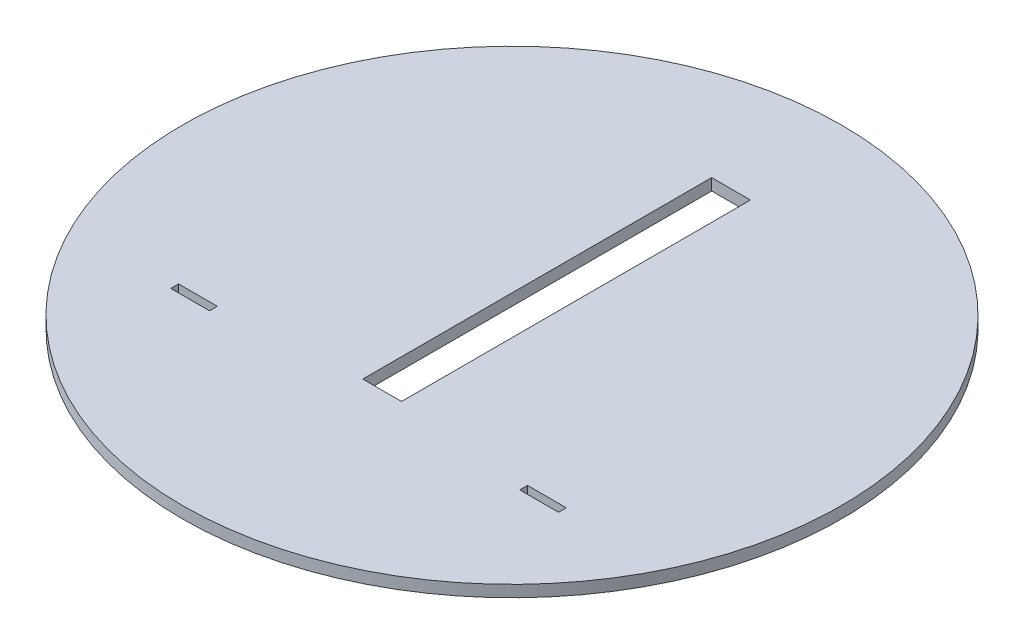
from build123d import *

# Parameters (mm, degrees)
SKETCH1_R           = 8.5
BOSS_EXTRUDE1_DEPTH = 0.15
CUT_EXTRUDE1_REACH  = 14.025
SKETCH2_W           = 1
SKETCH2_H           = 9
SKETCH2_H_2         = 0.2


with BuildPart() as part:
    # Sketch1 → Boss-Extrude1 (new, symmetric)
    with BuildSketch(Plane(origin=(0, 0, 0), x_dir=(1, 0, 0), z_dir=(0, 1, 0))):
        Circle(SKETCH1_R)
    extrude(amount=BOSS_EXTRUDE1_DEPTH, both=True)

    # Sketch2 → Cut-Extrude1 (cut, up to next)
    with BuildSketch(Plane(origin=(0, 0.15, 0), x_dir=(1, 0, 0), z_dir=(0, 1, 0)), mode=Mode.PRIVATE) as cut_extrude1_sk1:
        with Locations((0, 1.15)):
            Rectangle(SKETCH2_W, SKETCH2_H)
    cut_extrude1_tool1 = extrude(cut_extrude1_sk1.sketch, amount=-CUT_EXTRUDE1_REACH, mode=Mode.PRIVATE) & part.part
    # Sketch2 → Cut-Extrude1 (cut, up to next)
    with BuildSketch(Plane(origin=(0, 0.15, 0), x_dir=(1, 0, 0), z_dir=(0, 1, 0)), mode=Mode.PRIVATE) as cut_extrude1_sk2:
        with Locations((4.5, -3.7)):
            Rectangle(SKETCH2_W, SKETCH2_H_2)
    cut_extrude1_tool2 = extrude(cut_extrude1_sk2.sketch, amount=-CUT_EXTRUDE1_REACH, mode=Mode.PRIVATE) & part.part
    # Sketch2 → Cut-Extrude1 (cut, up to next)
    with BuildSketch(Plane(origin=(0, 0.15, 0), x_dir=(1, 0, 0), z_dir=(0, 1, 0)), mode=Mode.PRIVATE) as cut_extrude1_sk3:
        with Locations((-4.5, -3.7)):
            Rectangle(SKETCH2_W, SKETCH2_H_2)
    cut_extrude1_tool3 = extrude(cut_extrude1_sk3.sketch, amount=-CUT_EXTRUDE1_REACH, mode=Mode.PRIVATE) & part.part
    add(cut_extrude1_tool1.solids().sort_by_distance((0, 0.15, -1.15))[0], mode=Mode.SUBTRACT)
    add(cut_extrude1_tool2.solids().sort_by_distance((4.5, 0.15, 3.7))[0], mode=Mode.SUBTRACT)
    add(cut_extrude1_tool3.solids().sort_by_distance((-4.5, 0.15, 3.7))[0], mode=Mode.SUBTRACT)


solid = part.part
